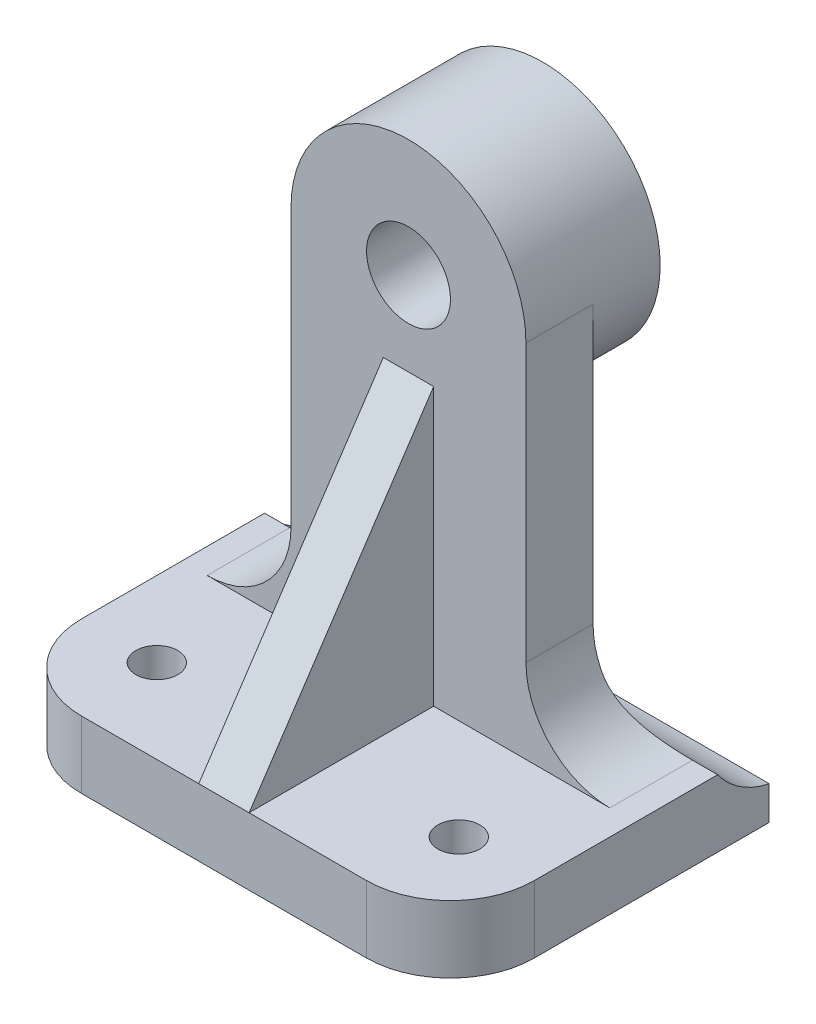
from build123d import *

# Parameters (mm, degrees)
Y_KSEKLIK_EKSTR_ZYON1_DEPTH = 54
IZIM2_R                     = 5
Y_KSEKLIK_EKSTR_ZYON2_DEPTH = 8
FEDER2_REACH                = 82.985
IZIM6_WALL_W                = 203.630625642
IZIM6_WALL_H                = 6
Y_KSEKLIK_EKSTR_ZYON3_START = 8
IZIM7_R                     = 14
IZIM7_R_2                   = 5
Y_KSEKLIK_EKSTR_ZYON3_DEPTH = 8
RADYUS1_R                   = 10
RADYUS2_START               = 13.0000001
RADYUS2_DEPTH               = 27.9999998
RADYUS2_2_DEPTH             = 54
RADYUS2_START_2             = -1.083333333
RADYUS2_3_DEPTH             = 8
RADYUS3_R                   = 10
IZIM9_R                     = 2.5
KES_EKSTR_ZYON1_DEPTH       = 87.763127471


with BuildPart() as part:
    # Çizim1 → Yükseklik-Ekstrüzyon1 (new body)
    with BuildSketch(Plane(origin=(0, 0, 0), x_dir=(0, 0, -1), z_dir=(1, 0, 0))):
        Polygon((-6.916666667, 9.833333333), (-36.916666667, 9.833333333), (-36.916666667, 1.833333333), (-19.333333333, 1.833333333), (1.083333333, 1.833333333), (1.083333333, 5.833333333), (-6.916666667, 5.833333333), align=None)
    extrude(amount=Y_KSEKLIK_EKSTR_ZYON1_DEPTH)

    # Çizim2 → Yükseklik-Ekstrüzyon2 (add)
    with BuildSketch(Plane(origin=(0, 0, 6.916666667), x_dir=(-1, 0, 0), z_dir=(0, 0, -1))):
        with BuildLine():
            ThreePointArc((-13, 52.833333333), (-27, 66.833333333), (-41, 52.833333333))
            Line((-41, 52.833333333), (-41, 9.833333333))
            Line((-41, 9.833333333), (-13, 9.833333333))
            Line((-13, 9.833333333), (-13, 52.833333333))
        make_face()
        with Locations((-27, 52.833333333)):
            Circle(IZIM2_R, mode=Mode.SUBTRACT)
    extrude(amount=-Y_KSEKLIK_EKSTR_ZYON2_DEPTH)

    # Çizim6 wall → Feder2 (add, up to next)
    with BuildSketch(Plane(origin=(27, 26.333333333, 25.916666667), x_dir=(0, 0.832050294338, -0.554700196225), z_dir=(0, 0.554700196225, 0.832050294338)), mode=Mode.PRIVATE) as feder2_sk1:
        Rectangle(IZIM6_WALL_W, IZIM6_WALL_H)
    feder2_tool1 = extrude(feder2_sk1.sketch, amount=-FEDER2_REACH, mode=Mode.PRIVATE) - part.part
    add(feder2_tool1.solids().sort_by_distance((27, 26.333333333, 25.916666667))[0])

    # Çizim7 → Yükseklik-Ekstrüzyon3 (add)
    with BuildSketch(Plane(origin=(0, 0, 6.916666667), x_dir=(-1, 0, 0), z_dir=(0, 0, -1)).offset(Y_KSEKLIK_EKSTR_ZYON3_START)):
        with Locations((-27, 52.833333333)):
            Circle(IZIM7_R)
        with Locations((-27, 52.833333333)):
            Circle(IZIM7_R_2, mode=Mode.SUBTRACT)
    extrude(amount=-Y_KSEKLIK_EKSTR_ZYON3_DEPTH)

    # Radyus1
    radyus1_edges = [part.edges().sort_by_distance(p)[0] for p in [
        (13, 9.833333333, 10.916666667),
        (41, 9.833333333, 10.916666667),
    ]]
    fillet(radyus1_edges, radius=RADYUS1_R)

    # Radyus2: read off the stored shape, not the designer's step
    # Radyus2 outline → Radyus2 (add)
    with BuildSketch(Plane.YZ.offset(RADYUS2_START)):
        with BuildLine():
            Line((5.833333333, 6.916666667), (5.833333333, -1.083333333))
            ThreePointArc((5.833333333, -1.083333333), (9.306736984, 4.662633359), (15.631292304, 6.916666667))
            Line((15.631292304, 6.916666667), (5.833333333, 6.916666667))
        make_face()
    extrude(amount=RADYUS2_DEPTH)

    # Radyus2 2 outline → Radyus2 2 (add)
    with BuildSketch(Plane.YZ):
        with BuildLine():
            Line((5.833333333, 6.916666667), (5.833333333, -1.083333333))
            ThreePointArc((5.833333333, -1.083333333), (9.306736984, 4.662633359), (15.631292304, 6.916666667))
            Line((15.631292304, 6.916666667), (5.833333333, 6.916666667))
        make_face()
    extrude(amount=RADYUS2_2_DEPTH)

    # Radyus2 3 outline → Radyus2 3 (cut)
    with BuildSketch(Plane.XY.offset(RADYUS2_START_2)):
        with BuildLine():
            Line((-1, 9.833333333), (3, 9.833333333))
            ThreePointArc((3, 9.833333333), (8.986094999, 11.822923439), (12.590214921, 17))
            Line((12.590214921, 17), (-1, 17))
            Line((-1, 17), (-1, 9.833333333))
        make_face()
        with BuildLine():
            Line((55, 17), (41.409785079, 17))
            ThreePointArc((41.409785079, 17), (45.013905001, 11.822923439), (51, 9.833333333))
            Line((51, 9.833333333), (55, 9.833333333))
            Line((55, 9.833333333), (55, 17))
        make_face()
    extrude(amount=RADYUS2_3_DEPTH, mode=Mode.SUBTRACT)

    # Radyus3
    radyus3_edges = [part.edges().sort_by_distance(p)[0] for p in [
        (54, 5.833333333, 36.916666667),
        (0, 5.833333333, 36.916666667),
    ]]
    fillet(radyus3_edges, radius=RADYUS3_R)

    # Çizim9 → Kes-Ekstrüzyon1 (cut, through all)
    with BuildSketch(Plane(origin=(0, 9.833333333, 0), x_dir=(1, 0, 0), z_dir=(0, 1, 0))):
        with Locations(Location((9, -26.916666667, 0), (0, 0, 270))):
            Circle(IZIM9_R)
        with Locations(Location((45, -26.916666667, 0), (0, 0, 270))):
            Circle(IZIM9_R)
    extrude(amount=-KES_EKSTR_ZYON1_DEPTH, mode=Mode.SUBTRACT)


solid = part.part
